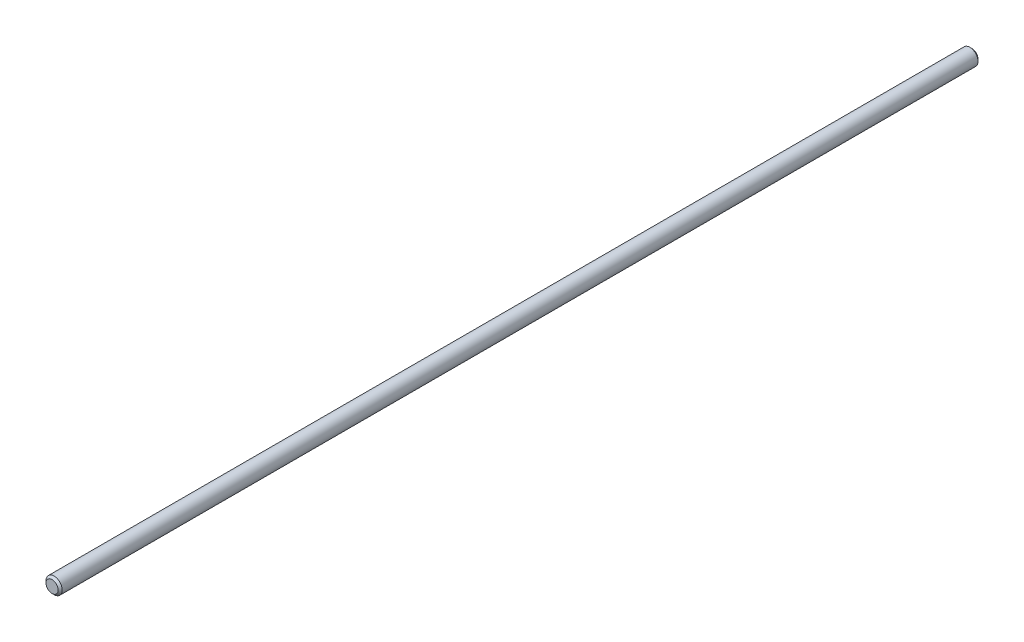
from build123d import *

# Parameters (mm, degrees)
SCHIZZO1_R                   = 4
ESTRUSIONE_ESTRUSIONE1_DEPTH = 455
SMUSSO1_SIZE                 = 1


with BuildPart() as part:
    # Schizzo1 → Estrusione-Estrusione1 (new body)
    with BuildSketch(Plane.XY):
        Circle(SCHIZZO1_R)
    extrude(amount=ESTRUSIONE_ESTRUSIONE1_DEPTH)

    # Smusso1
    smusso1_edges = [part.edges().sort_by_distance(p)[0] for p in [
        (-4, 0, 0),
        (-4, 0, 455),
    ]]
    chamfer(smusso1_edges, length=SMUSSO1_SIZE)


solid = part.part
